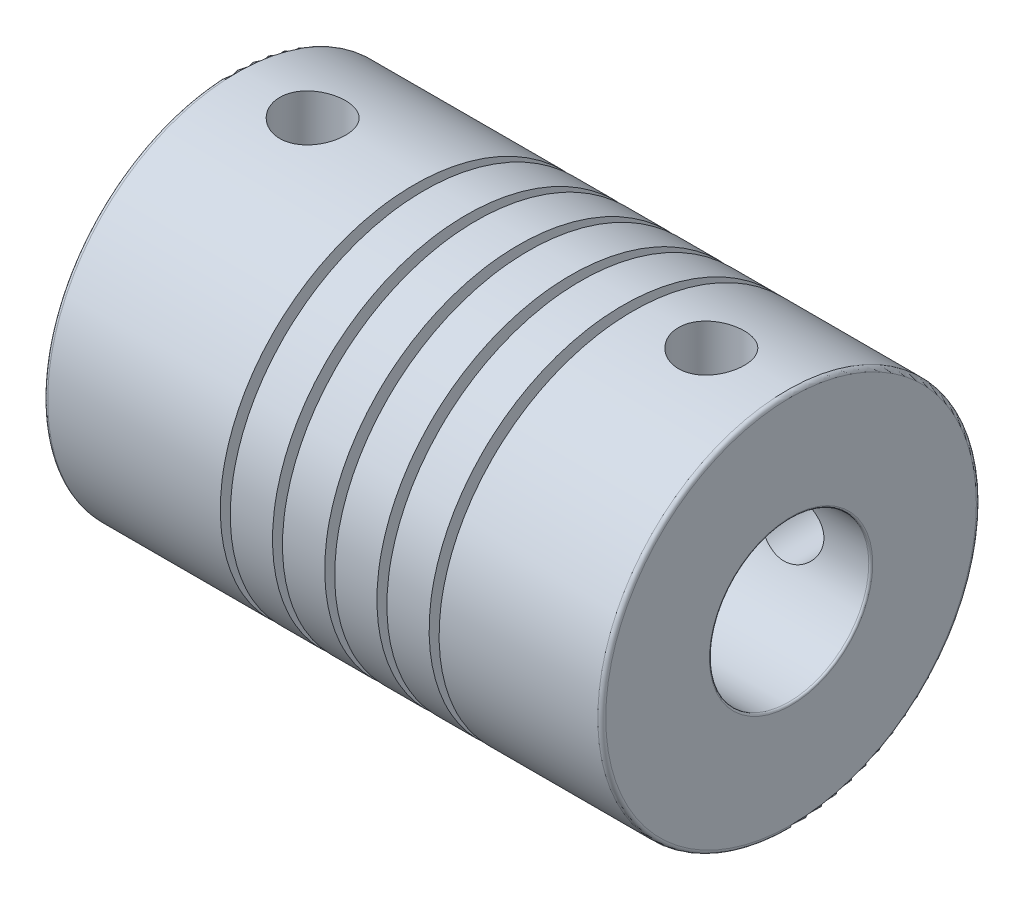
from build123d import *

# Parameters (mm, degrees)
BOSS_EXTRUDE1_DEPTH      = 28
BOSS_EXTRUDE1_DEPTH_BACK = 0.01
SKETCH1_R                = 9.5
SKETCH1_R_2              = 2.5
SKETCH2_R                = 4
CUT_EXTRUDE1_DEPTH       = 18
CUT_SWEEP2_PITCH         = 2.62
SKETCH8_R                = 1.65
CUT_EXTRUDE3_DEPTH       = 10
SKETCH10_R               = 1.65
CUT_EXTRUDE4_DEPTH       = 11
FILLET1_R                = 0.2
FILLET2_R                = 0.1


with BuildPart() as part:
    # Sketch1 → Boss-Extrude1 (new, two sides: drawn at the far end of the back side and taken through both)
    with BuildSketch(Plane(origin=(0, 0, 0), x_dir=(0, 0, -1), z_dir=(1, 0, 0)).offset(-BOSS_EXTRUDE1_DEPTH_BACK)):
        Circle(SKETCH1_R)
        Circle(SKETCH1_R_2, mode=Mode.SUBTRACT)
    extrude(amount=BOSS_EXTRUDE1_DEPTH + BOSS_EXTRUDE1_DEPTH_BACK)

    # Sketch2 → Cut-Extrude1 (cut)
    with BuildSketch(Plane(origin=(28, 0, 0), x_dir=(0, 0, -1), z_dir=(1, 0, 0))):
        Circle(SKETCH2_R)
    extrude(amount=-CUT_EXTRUDE1_DEPTH, mode=Mode.SUBTRACT)

    # Cut-Sweep2: arcs per turn and ends read off the stored shape
    # Cut-Sweep2: the profile of Sketch3 profile screwed along a left-hand helix through 5 turns, 10 arcs to a turn; built about Z, then put on its axis
    cut_sweep2_z = Axis((0, 0, 0), (0, 0, 1))
    cut_sweep2_corners = [(9.5003, 0, -0.2375), (9.5003, 0, 0.2625), (4, 0, 0.2625), (4, 0, -0.2375)]
    with BuildLine(mode=Mode.PRIVATE) as cut_sweep2_profile:
        Line(cut_sweep2_corners[0], cut_sweep2_corners[1])
        Line(cut_sweep2_corners[1], cut_sweep2_corners[2])
        Line(cut_sweep2_corners[2], cut_sweep2_corners[3])
        Line(cut_sweep2_corners[3], cut_sweep2_corners[0])
    cut_sweep2_cap = Face(cut_sweep2_profile.wire())
    cut_sweep2_turn_angles = [0, -18, -36, -54, -72, -90, -108, -126, -144, -162, -180, -198, -216, -234, -252, -270, -288, -306, -324, -342, -360]
    cut_sweep2_turn_weights = [1, 0.9510565162951535, 1, 0.9510565162951535, 1, 0.9510565162951535, 1, 0.9510565162951535, 1, 0.9510565162951535, 1, 0.9510565162951535, 1, 0.9510565162951535, 1, 0.9510565162951535, 1, 0.9510565162951535, 1, 0.9510565162951535, 1]
    cut_sweep2_turn_rails = [Edge.make_bspline([Vector(p[0], p[1], 0).rotate(cut_sweep2_z, cut_sweep2_turn_angles[k]) / cut_sweep2_turn_weights[k] + Vector(0, 0, p[2] + -CUT_SWEEP2_PITCH * cut_sweep2_turn_angles[k] / 360) for k in range(21)], [0, 0, 0, 1, 1, 2, 2, 3, 3, 4, 4, 5, 5, 6, 6, 7, 7, 8, 8, 9, 9, 10, 10, 10], 2, cut_sweep2_turn_weights) for p in cut_sweep2_corners]
    cut_sweep2_turn_sides = [Face.make_surface_from_curves(cut_sweep2_turn_rails[p[0]], cut_sweep2_turn_rails[p[1]]) for p in [(0, 1), (1, 2), (2, 3), (3, 0)]]
    cut_sweep2 = Plane(origin=(20.59, 0, 0), x_dir=(0, 0.7071067811865438, -0.7071067811865513), z_dir=(-1, 0, 0)) * Solid(Shell([*[p.moved(Location((0, 0, CUT_SWEEP2_PITCH * i))) for i in range(5) for p in cut_sweep2_turn_sides], cut_sweep2_cap, cut_sweep2_cap.rotate(cut_sweep2_z, -1800).moved(Location((0, 0, -CUT_SWEEP2_PITCH * -1800 / 360)))]))
    add(cut_sweep2, mode=Mode.SUBTRACT)

    # Sketch8 → Cut-Extrude3 (cut)
    with BuildSketch(Plane.XY):
        with Locations((4, 0)):
            Circle(SKETCH8_R)
        with Locations((24, 0)):
            Circle(SKETCH8_R)
    extrude(amount=-CUT_EXTRUDE3_DEPTH, mode=Mode.SUBTRACT)

    # Sketch10 → Cut-Extrude4 (cut)
    with BuildSketch(Plane(origin=(0, 0, 0), x_dir=(1, 0, 0), z_dir=(0, 1, 0))):
        with Locations(Location((3.99, 0, 0), (0, 0, 90))):
            Circle(SKETCH10_R)
        with Locations(Location((24, 0, 0), (0, 0, 90))):
            Circle(SKETCH10_R)
    extrude(amount=CUT_EXTRUDE4_DEPTH, mode=Mode.SUBTRACT)

    # Fillet1
    fillet1_edges = [part.edges().sort_by_distance(p)[0] for p in [
        (-0.01, 0, 9.5),
        (28, 0, 9.5),
    ]]
    fillet(fillet1_edges, radius=FILLET1_R)

    # Fillet2
    fillet2_edges = [part.edges().sort_by_distance(p)[0] for p in [
        (28, 0, 4),
        (-0.01, 0, 2.5),
    ]]
    fillet(fillet2_edges, radius=FILLET2_R)


solid = part.part
